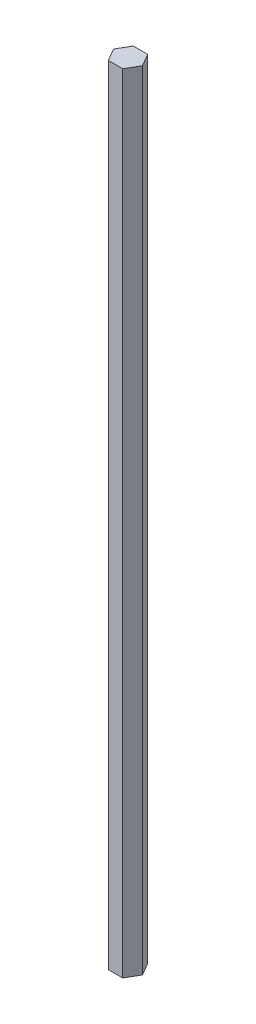
from build123d import *

# Parameters (mm, degrees)
BOSS_EXTRUDE1_DEPTH = 200


with BuildPart() as part:
    # Sketch1 → Boss-Extrude1 (new, symmetric)
    with BuildSketch(Plane(origin=(0, 0, 0), x_dir=(1, 0, 0), z_dir=(0, 1, 0))):
        Polygon((7.332348419, 0), (3.666174209, 6.35), (-3.666174209, 6.35), (-7.332348419, 0), (-3.666174209, -6.35), (3.666174209, -6.35), align=None)
    extrude(amount=BOSS_EXTRUDE1_DEPTH, both=True)


solid = part.part
